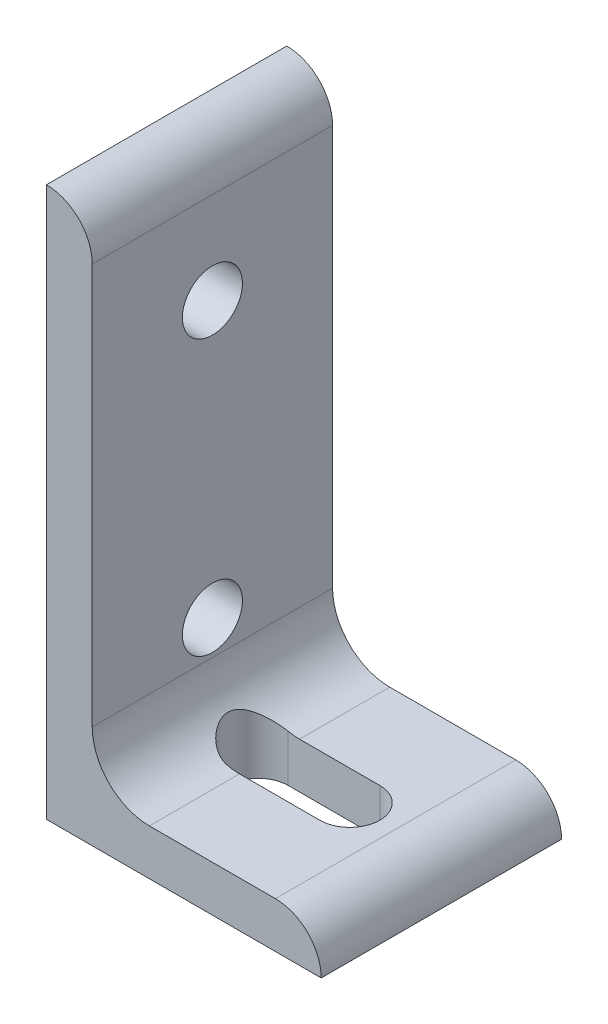
from build123d import *

# Parameters (mm, degrees)
BOSS_EXTRUDE1_DEPTH = 16.6624
FILLET1_R           = 6.35
CUT_EXTRUDE1_REACH  = 88.808
SKETCH3_R           = 4.1656
CUT_EXTRUDE2_REACH  = 88.808


with BuildPart() as part:
    # Sketch2 → Boss-Extrude1 (new, symmetric)
    with BuildSketch(Plane.XY):
        with BuildLine():
            Line((0, 0), (0, 76.2))
            Line((0, 76.2), (6.35, 76.2))
            Line((6.35, 76.2), (6.35, 14.2748))
            ThreePointArc((6.35, 14.2748), (8.67112018, 8.67112018), (14.2748, 6.35))
            Line((14.2748, 6.35), (38.1, 6.35))
            Line((38.1, 6.35), (38.1, 0))
            Line((38.1, 0), (0, 0))
        make_face()
    extrude(amount=BOSS_EXTRUDE1_DEPTH, both=True)

    # Fillet1
    fillet1_edges = [part.edges().sort_by_distance(p)[0] for p in [
        (38.1, 6.35, 0),
        (6.35, 76.2, 0),
    ]]
    fillet(fillet1_edges, radius=FILLET1_R - 0.0001)  # a hair under: the kernel refuses the full size

    # Sketch3 → Cut-Extrude1 (cut, up to next)
    with BuildSketch(Plane.ZY, mode=Mode.PRIVATE) as cut_extrude1_sk1:
        with Locations(Location((0, 57.15, 0), (0, 0, 270))):
            Circle(SKETCH3_R)
    cut_extrude1_tool1 = extrude(cut_extrude1_sk1.sketch, amount=-CUT_EXTRUDE1_REACH, mode=Mode.PRIVATE) & part.part
    # Sketch3 → Cut-Extrude1 (cut, up to next)
    with BuildSketch(Plane.ZY, mode=Mode.PRIVATE) as cut_extrude1_sk2:
        with Locations(Location((0, 19.05, 0), (0, 0, 270))):
            Circle(SKETCH3_R)
    cut_extrude1_tool2 = extrude(cut_extrude1_sk2.sketch, amount=-CUT_EXTRUDE1_REACH, mode=Mode.PRIVATE) & part.part
    add(cut_extrude1_tool1.solids().sort_by_distance((0, 57.15, 0))[0], mode=Mode.SUBTRACT)
    add(cut_extrude1_tool2.solids().sort_by_distance((0, 19.05, 0))[0], mode=Mode.SUBTRACT)

    # Sketch4 → Cut-Extrude2 (cut, up to next)
    with BuildSketch(Plane.XZ, mode=Mode.PRIVATE) as cut_extrude2_sk1:
        with BuildLine():
            Line((25.4, 4.1656), (12.7, 4.1656))
            ThreePointArc((12.7, 4.1656), (8.5344, 0), (12.7, -4.1656))
            Line((12.7, -4.1656), (25.4, -4.1656))
            ThreePointArc((25.4, -4.1656), (29.5656, 0), (25.4, 4.1656))
        make_face()
    cut_extrude2_tool1 = extrude(cut_extrude2_sk1.sketch, amount=-CUT_EXTRUDE2_REACH, mode=Mode.PRIVATE) & part.part
    add(cut_extrude2_tool1.solids().sort_by_distance((19.05, 0, 0))[0], mode=Mode.SUBTRACT)


solid = part.part
